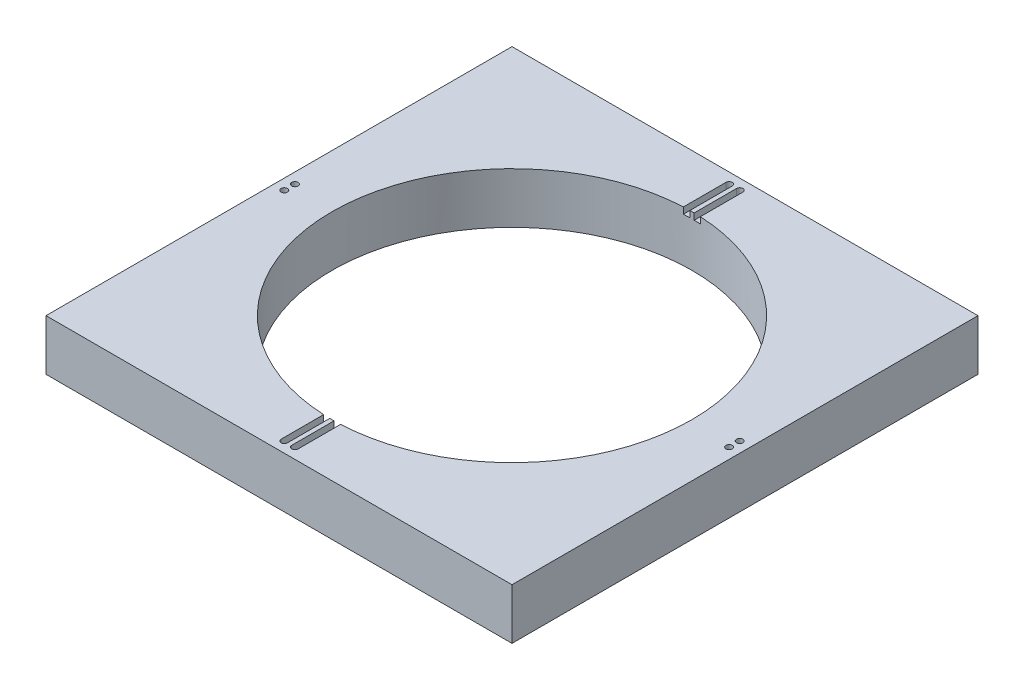
from build123d import *

# Parameters (mm, degrees)
SKETCH1_W           = 220
SKETCH1_H           = 220
SKETCH1_R           = 85
SKETCH1_R_2         = 1.5
BOSS_EXTRUDE1_DEPTH = 24
CUT_EXTRUDE1_START  = -3
CUT_EXTRUDE1_DEPTH  = 3


with BuildPart() as part:
    # Sketch1 → Boss-Extrude1 (new body)
    with BuildSketch(Plane(origin=(0, 0, 0), x_dir=(1, 0, 0), z_dir=(0, 1, 0))):
        Rectangle(SKETCH1_W, SKETCH1_H)
        Circle(SKETCH1_R, mode=Mode.SUBTRACT)
        with Locations((-105, 2.5)):
            Circle(SKETCH1_R_2, mode=Mode.SUBTRACT)
        with Locations((-105, -2.5)):
            Circle(SKETCH1_R_2, mode=Mode.SUBTRACT)
        with Locations((105, 2.5)):
            Circle(SKETCH1_R_2, mode=Mode.SUBTRACT)
        with Locations((105, -2.5)):
            Circle(SKETCH1_R_2, mode=Mode.SUBTRACT)
        with Locations((-2.5, -105)):
            Circle(SKETCH1_R_2, mode=Mode.SUBTRACT)
        with Locations((2.5, -105)):
            Circle(SKETCH1_R_2, mode=Mode.SUBTRACT)
        with Locations((-2.5, 105)):
            Circle(SKETCH1_R_2, mode=Mode.SUBTRACT)
        with Locations((2.5, 105)):
            Circle(SKETCH1_R_2, mode=Mode.SUBTRACT)
    extrude(amount=BOSS_EXTRUDE1_DEPTH)

    # Sketch2 → Cut-Extrude1 (cut)
    with BuildSketch(Plane(origin=(0, 24, 0), x_dir=(1, 0, 0), z_dir=(0, 1, 0)).offset(CUT_EXTRUDE1_START)):
        with BuildLine():
            Line((4, 105), (4, -105))
            ThreePointArc((4, -105), (2.5, -106.5), (1, -105))
            Line((1, -105), (1, 105))
            ThreePointArc((1, 105), (2.5, 106.5), (4, 105))
        make_face()
        with BuildLine():
            Line((-1, 105), (-1, -105))
            ThreePointArc((-1, -105), (-2.5, -106.5), (-4, -105))
            Line((-4, -105), (-4, 105))
            ThreePointArc((-4, 105), (-2.5, 106.5), (-1, 105))
        make_face()
    extrude(amount=CUT_EXTRUDE1_DEPTH, mode=Mode.SUBTRACT)


solid = part.part
